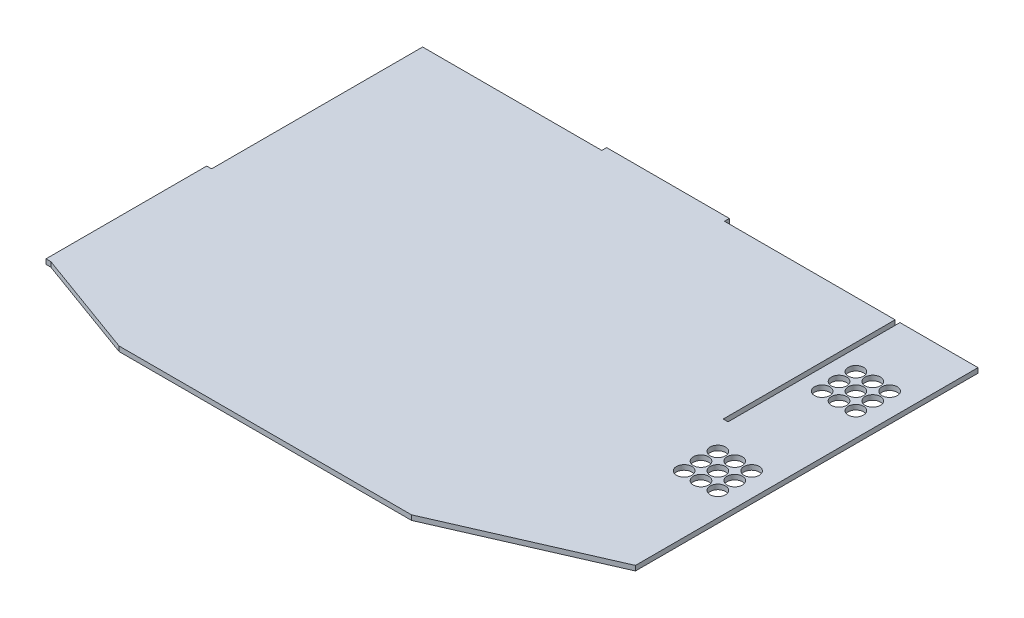
from build123d import *

# Parameters (mm, degrees)
SKETCH1_W                 = 308.1112
SKETCH1_H                 = 3.175
BOSS_EXTRUDE1_DEPTH       = 267.83
SKETCH3_W                 = 155.702
SKETCH3_H                 = 3.175
BOSS_EXTRUDE3_DEPTH       = 3.175
SKETCH4_W                 = 50.87366
SKETCH4_H                 = 3.175
BOSS_EXTRUDE4_DEPTH       = 267.83
CUT_EXTRUDE1_DEPTH        = 340.190761306
SKETCH8_W                 = 80
SKETCH8_H                 = 3.175
BOSS_EXTRUDE6_DEPTH       = 3.175
CUT_EXTRUDE3_DEPTH        = 340.190761306
SKETCH13_W                = 104.779999964
SKETCH13_H                = 3.1854967
BOSS_EXTRUDE7_DEPTH       = 3.175
SKETCH14_R                = 5
CUT_EXTRUDE4_DEPTH        = 340.190859723
LPATTERN1_COUNT           = 3
LPATTERN1_PITCH           = 11
LPATTERN2_COPY_1_SKETCH_R = 5
LPATTERN2_COPY_1_DEPTH    = 340.190859723
LPATTERN2_COPY_2_SKETCH_R = 5
LPATTERN2_COPY_2_DEPTH    = 340.190859723
LPATTERN2_COPY_3_SKETCH_R = 5
LPATTERN2_COPY_3_DEPTH    = 340.190859723
LPATTERN2_COPY_4_SKETCH_R = 5
LPATTERN2_COPY_4_DEPTH    = 340.190859723
LPATTERN2_COPY_5_SKETCH_R = 5
LPATTERN2_COPY_5_DEPTH    = 340.190859723
LPATTERN2_COPY_6_SKETCH_R = 5
LPATTERN2_COPY_6_DEPTH    = 340.190859723
SKETCH15_R                = 5
CUT_EXTRUDE5_DEPTH        = 340.190859723
LPATTERN3_COUNT           = 3
LPATTERN3_PITCH           = 11
LPATTERN4_COPY_1_SKETCH_R = 5
LPATTERN4_COPY_1_DEPTH    = 340.190859723
LPATTERN4_COPY_2_SKETCH_R = 5
LPATTERN4_COPY_2_DEPTH    = 340.190859723
LPATTERN4_COPY_3_SKETCH_R = 5
LPATTERN4_COPY_3_DEPTH    = 340.190859723
LPATTERN4_COPY_4_SKETCH_R = 5
LPATTERN4_COPY_4_DEPTH    = 340.190859723
LPATTERN4_COPY_5_SKETCH_R = 5
LPATTERN4_COPY_5_DEPTH    = 340.190859723
LPATTERN4_COPY_6_SKETCH_R = 5
LPATTERN4_COPY_6_DEPTH    = 340.190859723


with BuildPart() as part:
    # Sketch1 → Boss-Extrude1 (new body)
    with BuildSketch(Plane.XY):
        Rectangle(SKETCH1_W, SKETCH1_H)
    extrude(amount=BOSS_EXTRUDE1_DEPTH)

    # Sketch3 → Boss-Extrude3 (add)
    with BuildSketch(Plane(origin=(154.0556, 0, 0), x_dir=(0, 0, -1), z_dir=(1, 0, 0))):
        with Locations((-189.979, 0)):
            Rectangle(SKETCH3_W, SKETCH3_H)
    extrude(amount=BOSS_EXTRUDE3_DEPTH)

    # Sketch4 → Boss-Extrude4 (add)
    with BuildSketch(Plane.XY.offset(267.83)):
        with Locations((182.66743, 0)):
            Rectangle(SKETCH4_W, SKETCH4_H)
    extrude(amount=-BOSS_EXTRUDE4_DEPTH)

    # Sketch6 → Cut-Extrude1 (cut, through all)
    with BuildSketch(Plane(origin=(0, 1.5875, 0), x_dir=(1, 0, 0), z_dir=(0, 1, 0))):
        Polygon((208.10426, -223.38), (106.50426, -267.83), (208.10426, -267.83), align=None)
    extrude(amount=-CUT_EXTRUDE1_DEPTH, mode=Mode.SUBTRACT)

    # Sketch8 → Boss-Extrude6 (add)
    with BuildSketch(Plane(origin=(0, 0, 0), x_dir=(-1, 0, 0), z_dir=(0, 0, -1))):
        with Locations((-2.78399998, 0)):
            Rectangle(SKETCH8_W, SKETCH8_H)
    extrude(amount=BOSS_EXTRUDE6_DEPTH)

    # Sketch11 → Cut-Extrude3 (cut, through all)
    with BuildSketch(Plane.XZ.offset(1.5875)):
        Polygon((-154.0556, 242.43), (-84.2056, 267.83), (-154.0556, 267.83), align=None)
    extrude(amount=-CUT_EXTRUDE3_DEPTH, mode=Mode.SUBTRACT)

    # Sketch13 → Boss-Extrude7 (add)
    with BuildSketch(Plane.ZY.offset(154.0556)):
        with Locations((190.040000018, -0.00524835)):
            Rectangle(SKETCH13_W, SKETCH13_H)
    extrude(amount=BOSS_EXTRUDE7_DEPTH)

    # Sketch14 → Cut-Extrude4 (cut, through all)
    with BuildSketch(Plane(origin=(0, 1.5875, 0), x_dir=(1, 0, 0), z_dir=(0, 1, 0))):
        with Locations((170.589646205, -42.120100565)):
            Circle(SKETCH14_R)
    cut_extrude4 = extrude(amount=-CUT_EXTRUDE4_DEPTH, mode=Mode.SUBTRACT)

    # LPattern1: Cut-Extrude4 ×3
    with Locations(*[(i * LPATTERN1_PITCH, 0, 0) for i in range(1, LPATTERN1_COUNT)]):
        add(cut_extrude4, mode=Mode.SUBTRACT)

    # LPattern2 copy 1 sketch → LPattern2 copy 1 (cut, through all)
    with BuildSketch(Plane(origin=(11, 1.5875, 11), x_dir=(1, 0, 0), z_dir=(0, 1, 0))):
        with Locations((170.589646205, -42.120100565)):
            Circle(LPATTERN2_COPY_1_SKETCH_R)
    extrude(amount=-LPATTERN2_COPY_1_DEPTH, mode=Mode.SUBTRACT)

    # LPattern2 copy 2 sketch → LPattern2 copy 2 (cut, through all)
    with BuildSketch(Plane(origin=(11, 1.5875, 22), x_dir=(1, 0, 0), z_dir=(0, 1, 0))):
        with Locations((170.589646205, -42.120100565)):
            Circle(LPATTERN2_COPY_2_SKETCH_R)
    extrude(amount=-LPATTERN2_COPY_2_DEPTH, mode=Mode.SUBTRACT)

    # LPattern2 copy 3 sketch → LPattern2 copy 3 (cut, through all)
    with BuildSketch(Plane(origin=(22, 1.5875, 11), x_dir=(1, 0, 0), z_dir=(0, 1, 0))):
        with Locations((170.589646205, -42.120100565)):
            Circle(LPATTERN2_COPY_3_SKETCH_R)
    extrude(amount=-LPATTERN2_COPY_3_DEPTH, mode=Mode.SUBTRACT)

    # LPattern2 copy 4 sketch → LPattern2 copy 4 (cut, through all)
    with BuildSketch(Plane(origin=(22, 1.5875, 22), x_dir=(1, 0, 0), z_dir=(0, 1, 0))):
        with Locations((170.589646205, -42.120100565)):
            Circle(LPATTERN2_COPY_4_SKETCH_R)
    extrude(amount=-LPATTERN2_COPY_4_DEPTH, mode=Mode.SUBTRACT)

    # LPattern2 copy 5 sketch → LPattern2 copy 5 (cut, through all)
    with BuildSketch(Plane(origin=(0, 1.5875, 11), x_dir=(1, 0, 0), z_dir=(0, 1, 0))):
        with Locations((170.589646205, -42.120100565)):
            Circle(LPATTERN2_COPY_5_SKETCH_R)
    extrude(amount=-LPATTERN2_COPY_5_DEPTH, mode=Mode.SUBTRACT)

    # LPattern2 copy 6 sketch → LPattern2 copy 6 (cut, through all)
    with BuildSketch(Plane(origin=(0, 1.5875, 22), x_dir=(1, 0, 0), z_dir=(0, 1, 0))):
        with Locations((170.589646205, -42.120100565)):
            Circle(LPATTERN2_COPY_6_SKETCH_R)
    extrude(amount=-LPATTERN2_COPY_6_DEPTH, mode=Mode.SUBTRACT)

    # Sketch15 → Cut-Extrude5 (cut, through all)
    with BuildSketch(Plane(origin=(0, 1.5875, 0), x_dir=(1, 0, 0), z_dir=(0, 1, 0))):
        with Locations((170.589646205, -132.128447749)):
            Circle(SKETCH15_R)
    cut_extrude5 = extrude(amount=-CUT_EXTRUDE5_DEPTH, mode=Mode.SUBTRACT)

    # LPattern3: Cut-Extrude5 ×3
    with Locations(*[(i * LPATTERN3_PITCH, 0, 0) for i in range(1, LPATTERN3_COUNT)]):
        add(cut_extrude5, mode=Mode.SUBTRACT)

    # LPattern4 copy 1 sketch → LPattern4 copy 1 (cut, through all)
    with BuildSketch(Plane(origin=(11, 1.5875, 11), x_dir=(1, 0, 0), z_dir=(0, 1, 0))):
        with Locations((170.589646205, -132.128447749)):
            Circle(LPATTERN4_COPY_1_SKETCH_R)
    extrude(amount=-LPATTERN4_COPY_1_DEPTH, mode=Mode.SUBTRACT)

    # LPattern4 copy 2 sketch → LPattern4 copy 2 (cut, through all)
    with BuildSketch(Plane(origin=(11, 1.5875, 22), x_dir=(1, 0, 0), z_dir=(0, 1, 0))):
        with Locations((170.589646205, -132.128447749)):
            Circle(LPATTERN4_COPY_2_SKETCH_R)
    extrude(amount=-LPATTERN4_COPY_2_DEPTH, mode=Mode.SUBTRACT)

    # LPattern4 copy 3 sketch → LPattern4 copy 3 (cut, through all)
    with BuildSketch(Plane(origin=(22, 1.5875, 11), x_dir=(1, 0, 0), z_dir=(0, 1, 0))):
        with Locations((170.589646205, -132.128447749)):
            Circle(LPATTERN4_COPY_3_SKETCH_R)
    extrude(amount=-LPATTERN4_COPY_3_DEPTH, mode=Mode.SUBTRACT)

    # LPattern4 copy 4 sketch → LPattern4 copy 4 (cut, through all)
    with BuildSketch(Plane(origin=(22, 1.5875, 22), x_dir=(1, 0, 0), z_dir=(0, 1, 0))):
        with Locations((170.589646205, -132.128447749)):
            Circle(LPATTERN4_COPY_4_SKETCH_R)
    extrude(amount=-LPATTERN4_COPY_4_DEPTH, mode=Mode.SUBTRACT)

    # LPattern4 copy 5 sketch → LPattern4 copy 5 (cut, through all)
    with BuildSketch(Plane(origin=(0, 1.5875, 11), x_dir=(1, 0, 0), z_dir=(0, 1, 0))):
        with Locations((170.589646205, -132.128447749)):
            Circle(LPATTERN4_COPY_5_SKETCH_R)
    extrude(amount=-LPATTERN4_COPY_5_DEPTH, mode=Mode.SUBTRACT)

    # LPattern4 copy 6 sketch → LPattern4 copy 6 (cut, through all)
    with BuildSketch(Plane(origin=(0, 1.5875, 22), x_dir=(1, 0, 0), z_dir=(0, 1, 0))):
        with Locations((170.589646205, -132.128447749)):
            Circle(LPATTERN4_COPY_6_SKETCH_R)
    extrude(amount=-LPATTERN4_COPY_6_DEPTH, mode=Mode.SUBTRACT)


solid = part.part
